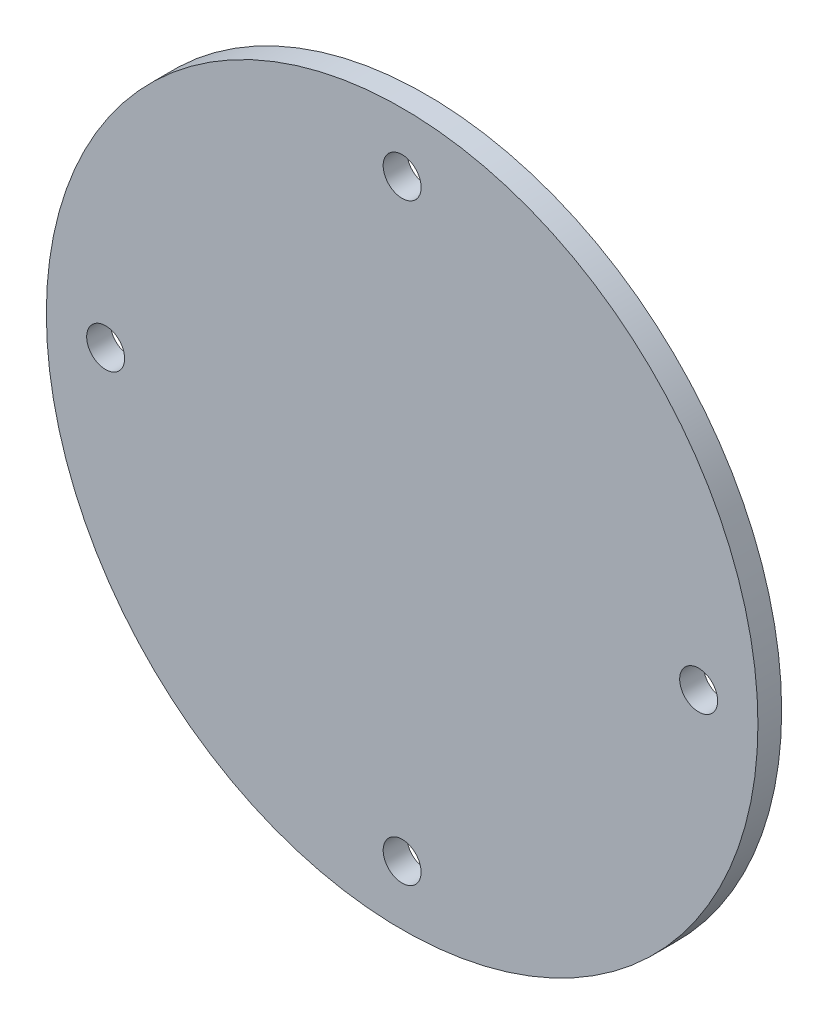
from build123d import *

# Parameters (mm, degrees)
SKETCH_3_R      = 30
SKETCH_3_R_2    = 1.6
EXTRUDE_1_DEPTH = 2


with BuildPart() as part:
    # 草图3 → 凸台-拉伸1 (new body)
    with BuildSketch(Plane.XY):
        with Locations((2.003468414, 0)):
            Circle(SKETCH_3_R)
        with Locations((2.003468414, 25)):
            Circle(SKETCH_3_R_2, mode=Mode.SUBTRACT)
        with Locations((27.003468414, 0)):
            Circle(SKETCH_3_R_2, mode=Mode.SUBTRACT)
        with Locations((2.003468414, -25)):
            Circle(SKETCH_3_R_2, mode=Mode.SUBTRACT)
        with Locations((-22.996531586, 0)):
            Circle(SKETCH_3_R_2, mode=Mode.SUBTRACT)
    extrude(amount=EXTRUDE_1_DEPTH)


solid = part.part
